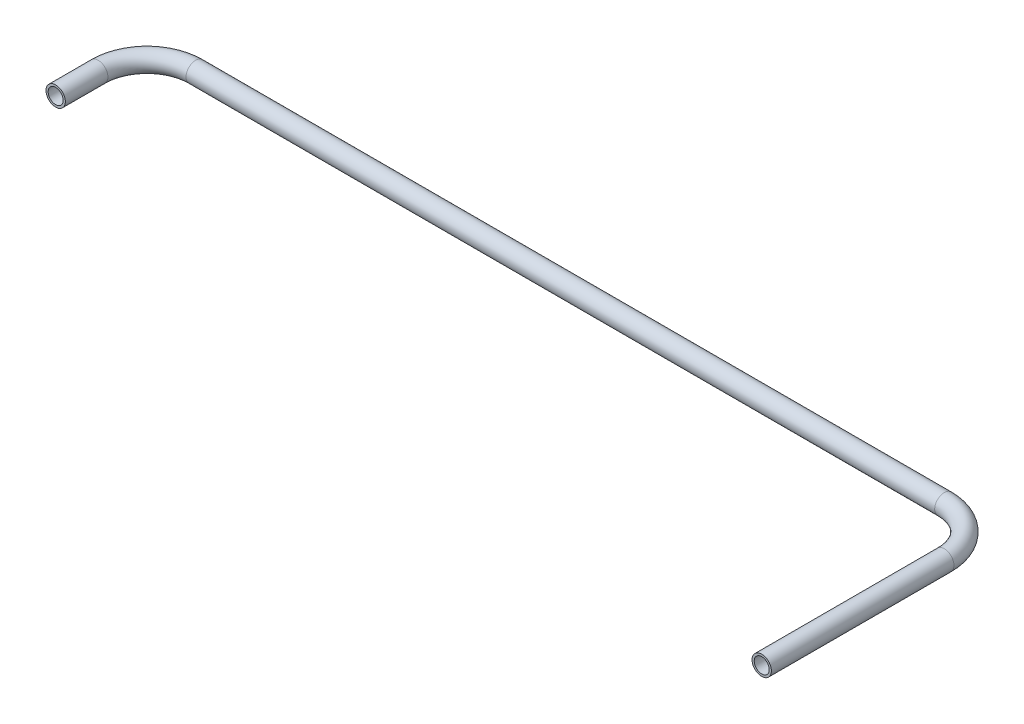
from build123d import *

# Parameters (mm, degrees)
SKETCH2_R   = 3.175
SKETCH2_R_2 = 2.4638


with BuildPart() as part:
    # Sweep-Thin1: sweep along a path in Sketch1
    with BuildLine(Plane(origin=(0, 0, 0), x_dir=(1, 0, 0), z_dir=(0, 1, 0))) as sweep_thin1_path:
        Line((0, 0), (0, 14))
        ThreePointArc((0, 14), (4.686291501, 25.313708499), (16, 30))
        Line((16, 30), (262, 30))
        ThreePointArc((262, 30), (273.313708499, 25.313708499), (278, 14))
        Line((278, 14), (278, -46))
    # Sketch2 → Sweep-Thin1 (sweep)
    with BuildSketch(Plane.XY):
        Circle(SKETCH2_R)
        Circle(SKETCH2_R_2, mode=Mode.SUBTRACT)
    sweep(path=sweep_thin1_path.line)


solid = part.part
